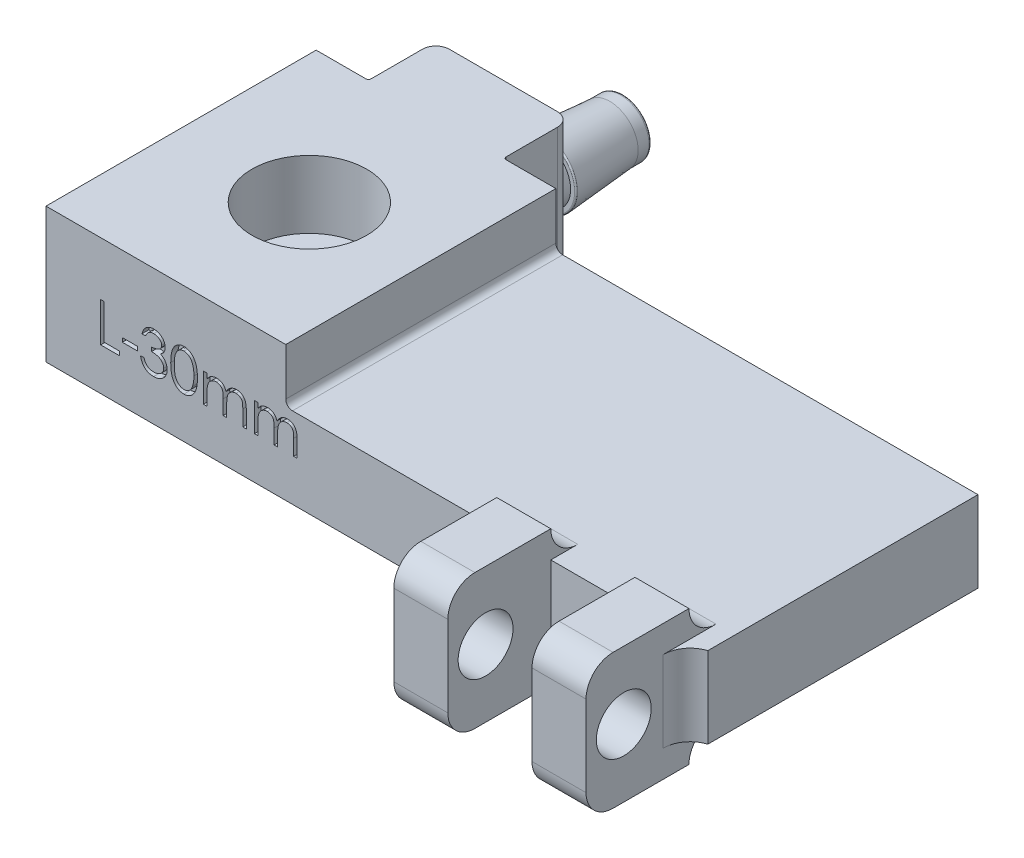
from build123d import *

# Parameters (mm, degrees)
SKETCH2_W           = 49
SKETCH2_H           = 20
BOSS_EXTRUDE1_DEPTH = 10
SKETCH3_W           = 30
SKETCH3_H           = 3.02
CUT_EXTRUDE1_DEPTH  = 2
SKETCH4_W           = 5
SKETCH4_H           = 6
CUT_EXTRUDE2_DEPTH  = 5
SKETCH5_R           = 4.25
CUT_EXTRUDE3_DEPTH  = 38.474986727
SKETCH6_W           = 1.65
SKETCH6_H           = 6
BOSS_EXTRUDE2_DEPTH = 0.5
SKETCH11_R          = 2
CUT_EXTRUDE4_DEPTH  = 2
SKETCH12_W          = 5
SKETCH12_H          = 6
BOSS_EXTRUDE4_DEPTH = 0.8
SKETCH14_W          = 31.25
SKETCH14_H          = 4
CUT_EXTRUDE6_DEPTH  = 42.177221974
FILLET1_R           = 0.5
SKETCH13_W          = 1.119391026
SKETCH13_H          = 0.298504274
CUT_EXTRUDE5_DEPTH  = 0.5
SKETCH19_W          = 10
SKETCH19_H          = 4.99
BOSS_EXTRUDE5_DEPTH = 10
FILLET2_R           = 1
CUT_EXTRUDE7_REACH  = 45.819
SKETCH20_R          = 0.5
SKETCH21_R          = 1.4
CUT_EXTRUDE8_DEPTH  = 10
FILLET3_R           = 0.2
BOSS_EXTRUDE6_START = -0.5
SKETCH24_W          = 1.7
SKETCH24_H          = 1.5
BOSS_EXTRUDE6_DEPTH = 0.5
SKETCH28_W          = 4
SKETCH28_H          = 10
BOSS_EXTRUDE7_DEPTH = 7.62
CUT_EXTRUDE10_REACH = 57.414
SKETCH30_R          = 2.032
FILLET4_R           = 2
FILLET5_R           = 2


with BuildPart() as part:
    # Sketch2 → Boss-Extrude1 (new body)
    with BuildSketch(Plane(origin=(0, 0, 0), x_dir=(1, 0, 0), z_dir=(0, 1, 0))):
        with Locations((10.076923077, 3.557692308)):
            Rectangle(SKETCH2_W, SKETCH2_H)
    extrude(amount=BOSS_EXTRUDE1_DEPTH)

    # Sketch3 → Cut-Extrude1 (cut)
    with BuildSketch(Plane.XZ):
        with Locations((12.576923077, -3.557692308)):
            Rectangle(SKETCH3_W, SKETCH3_H)
    extrude(amount=-CUT_EXTRUDE1_DEPTH, mode=Mode.SUBTRACT)

    # Sketch4 → Cut-Extrude2 (cut)
    with BuildSketch(Plane.XZ):
        with Locations((-4.923076923, -3.547692308)):
            Rectangle(SKETCH4_W, SKETCH4_H)
    extrude(amount=-CUT_EXTRUDE2_DEPTH, mode=Mode.SUBTRACT)

    # Sketch5 → Cut-Extrude3 (cut, through all)
    with BuildSketch(Plane.XZ.offset(-5)):
        with Locations(Location((-4.923076923, -3.552692308, 0), (0, 0, 270))):
            Circle(SKETCH5_R)
    extrude(amount=-CUT_EXTRUDE3_DEPTH, mode=Mode.SUBTRACT)

    # Sketch6 → Boss-Extrude2 (add)
    with BuildSketch(Plane(origin=(0, 5, 0), x_dir=(1, 0, 0), z_dir=(0, 1, 0))):
        with Locations((-3.248076923, 3.547692308)):
            Rectangle(SKETCH6_W, SKETCH6_H)
        with Locations((-6.598076923, 3.547692308)):
            Rectangle(SKETCH6_W, SKETCH6_H)
    extrude(amount=-BOSS_EXTRUDE2_DEPTH)

    # Sketch11 → Cut-Extrude4 (cut)
    with BuildSketch(Plane.XZ):
        with Locations((28.888372657, -3.557692308)):
            Circle(SKETCH11_R)
    extrude(amount=-CUT_EXTRUDE4_DEPTH, mode=Mode.SUBTRACT)

    # Sketch12 → Boss-Extrude4 (add)
    with BuildSketch(Plane.XZ):
        with Locations((-4.923076923, -3.547692308)):
            Rectangle(SKETCH12_W, SKETCH12_H)
    extrude(amount=-BOSS_EXTRUDE4_DEPTH)

    # Sketch14 → Cut-Extrude6 (cut, through all)
    with BuildSketch(Plane.XY.offset(6.442307692)):
        with Locations((18.951923077, 8)):
            Rectangle(SKETCH14_W, SKETCH14_H)
    extrude(amount=-CUT_EXTRUDE6_DEPTH, mode=Mode.SUBTRACT)

    # Fillet1
    fillet1_edges = [part.edges().sort_by_distance(p)[0] for p in [
        (3.326923077, 6, -3.557692308),
    ]]
    fillet(fillet1_edges, radius=FILLET1_R)

    # Sketch13 → Cut-Extrude5 (cut)
    # profile 1 of 6: a face of its own
    with BuildSketch(Plane.XY.offset(6.442307692)):
        Polygon((-10.374825021, 6.036177607), (-10.113633781, 6.036177607), (-10.113633781, 3.424265214), (-8.994242756, 3.424265214), (-8.994242756, 3.12576094), (-10.374825021, 3.12576094), align=None)
    # profile 2 of 6: a face of its own
    with BuildSketch(Plane.XY.offset(6.442307692)):
        with Locations((-8.210669038, 4.245151966)):
            Rectangle(SKETCH13_W, SKETCH13_H)
    # profile 3 of 6: a face of its own
    with BuildSketch(Plane.XY.offset(6.442307692)):
        with BuildLine():
            Line((-7.053964978, 5.364542992), (-7.315156217, 5.364542992))
            add(Edge.make_bspline(
                [(-7.315156217, 5.364542992), (-7.308080121, 5.39384048), (-7.294246931, 5.451114673), (-7.265394246, 5.532944996), (-7.233962365, 5.610381639), (-7.196219163, 5.681974624), (-7.155050277, 5.749162759), (-7.107882633, 5.810422144), (-7.056892363, 5.867310783), (-7.000492688, 5.917796731), (-6.941345819, 5.963513331), (-6.878618341, 6.002492173), (-6.81357228, 6.036023626), (-6.745756966, 6.063647831), (-6.674970501, 6.084457746), (-6.601852832, 6.099555994), (-6.52621235, 6.109360867), (-6.474866288, 6.110317781), (-6.448794205, 6.110803675)],
                knots=[0, 0, 0, 0, 1.162005537, 2.271625781, 3.343758855, 4.383309926, 5.390229558, 6.379919256, 7.361854164, 8.333198761, 9.295911338, 10.242430842, 11.177959212, 12.116337295, 13.062827104, 14.020064771, 14.994644689, 16, 16, 16, 16], degree=3))
            add(Edge.make_bspline(
                [(-6.448794205, 6.110803675), (-6.410806829, 6.10965678), (-6.335660693, 6.107388006), (-6.225261898, 6.086670465), (-6.118801501, 6.05388659), (-6.017444787, 6.008589092), (-5.923298269, 5.952719642), (-5.839531333, 5.886225155), (-5.767279399, 5.810388593), (-5.706664253, 5.726624669), (-5.659203673, 5.637103987), (-5.624206849, 5.54496838), (-5.602901202, 5.450436407), (-5.60014, 5.386609075), (-5.598756645, 5.354631717)],
                knots=[0, 0, 0, 0, 1.083050992, 2.142477498, 3.193116406, 4.255571735, 5.30263384, 6.308962982, 7.297363603, 8.282367274, 9.249857812, 10.179914175, 11.08814088, 12, 12, 12, 12], degree=3))
            add(Edge.make_bspline(
                [(-5.598756645, 5.354631717), (-5.599724226, 5.323858805), (-5.601617633, 5.263640992), (-5.617694529, 5.175728532), (-5.644749981, 5.092871797), (-5.682227635, 5.014721985), (-5.730741412, 4.941774604), (-5.789509125, 4.873865526), (-5.858945565, 4.810693554), (-5.911565015, 4.77450504), (-5.938655065, 4.755874122)],
                knots=[0, 0, 0, 0, 1.024540389, 2.004866551, 2.965041327, 3.920577974, 4.882998113, 5.874504559, 6.905732034, 8, 8, 8, 8], degree=3))
            add(Edge.make_bspline(
                [(-5.938655065, 4.755874122), (-5.907695089, 4.740924416), (-5.84635442, 4.711304725), (-5.762741866, 4.653216336), (-5.686839967, 4.586146742), (-5.6445111, 4.533806929), (-5.623243323, 4.507509238)],
                knots=[0, 0, 0, 0, 1.015518401, 2.012035669, 3.001164323, 4, 4, 4, 4], degree=3))
            add(Edge.make_bspline(
                [(-5.623243323, 4.507509238), (-5.609238945, 4.488335619), (-5.58145952, 4.450302364), (-5.54717021, 4.389153324), (-5.51606275, 4.32732652), (-5.491822955, 4.2631648), (-5.47305171, 4.197411823), (-5.459633831, 4.129954688), (-5.45129828, 4.060738309), (-5.45010455, 4.0139118), (-5.449504508, 3.990373905)],
                knots=[0, 0, 0, 0, 1.025084078, 2.033381695, 3.024893161, 4.013698104, 4.991890475, 5.976764909, 6.982997093, 8, 8, 8, 8], degree=3))
            add(Edge.make_bspline(
                [(-5.449504508, 3.990373905), (-5.450996731, 3.949619988), (-5.453974156, 3.868303942), (-5.480587068, 3.748166331), (-5.52184284, 3.630730601), (-5.580431137, 3.51840944), (-5.65183406, 3.413318135), (-5.736782739, 3.3192898), (-5.834311973, 3.238464532), (-5.943083099, 3.17093436), (-6.06092764, 3.116952016), (-6.186969962, 3.079484607), (-6.319393965, 3.055082011), (-6.410205034, 3.05246524), (-6.456373415, 3.051134872)],
                knots=[0, 0, 0, 0, 0.955779014, 1.907060117, 2.875433937, 3.871313158, 4.872415639, 5.851225146, 6.836215519, 7.83643374, 8.849228613, 9.86973379, 10.916971861, 12, 12, 12, 12], degree=3))
            add(Edge.make_bspline(
                [(-6.456373415, 3.051134872), (-6.487489345, 3.051856833), (-6.548715119, 3.053277411), (-6.638724743, 3.062988724), (-6.724641656, 3.080725639), (-6.806582024, 3.104593804), (-6.88461864, 3.13485527), (-6.958513375, 3.172539926), (-7.028720852, 3.216870978), (-7.094578551, 3.268371706), (-7.156078622, 3.325982439), (-7.211586691, 3.390725913), (-7.262028198, 3.461405302), (-7.306052523, 3.538841558), (-7.345664917, 3.622033953), (-7.378245749, 3.712047734), (-7.406922141, 3.808078198), (-7.42025473, 3.874999271), (-7.42709532, 3.909334658)],
                knots=[0, 0, 0, 0, 1.048658725, 2.063410685, 3.046034179, 4.001477787, 4.936774919, 5.862367409, 6.792675028, 7.730719943, 8.675894397, 9.627829632, 10.600096036, 11.597688215, 12.626045268, 13.701542398, 14.82072376, 16, 16, 16, 16], degree=3))
            Line((-7.42709532, 3.909334658), (-7.16590408, 3.909334658))
            add(Edge.make_bspline(
                [(-7.16590408, 3.909334658), (-7.159099284, 3.886925271), (-7.145863364, 3.843337065), (-7.123333165, 3.780604858), (-7.097664727, 3.723096644), (-7.070128394, 3.67039056), (-7.04120846, 3.621967544), (-7.008848847, 3.579108025), (-6.97544629, 3.539929491), (-6.950267566, 3.517856382), (-6.937944762, 3.507053509)],
                knots=[0, 0, 0, 0, 1.198163088, 2.33053128, 3.407730985, 4.417276592, 5.372219308, 6.28897303, 7.162600585, 8, 8, 8, 8], degree=3))
            add(Edge.make_bspline(
                [(-6.937944762, 3.507053509), (-6.921649276, 3.494490209), (-6.889108603, 3.469402391), (-6.836082282, 3.437386454), (-6.780314636, 3.409645173), (-6.720597315, 3.388454266), (-6.658218961, 3.370511414), (-6.592171324, 3.35876953), (-6.523037106, 3.350713354), (-6.475832008, 3.350002438), (-6.451709285, 3.349639146)],
                knots=[0, 0, 0, 0, 0.946170439, 1.889420265, 2.845303464, 3.807233317, 4.801018734, 5.828864929, 6.890507805, 8, 8, 8, 8], degree=3))
            add(Edge.make_bspline(
                [(-6.451709285, 3.349639146), (-6.424473188, 3.3501513), (-6.371215352, 3.351152774), (-6.293503186, 3.360362752), (-6.219572409, 3.373775959), (-6.150243852, 3.39449229), (-6.084609376, 3.420088034), (-6.02358904, 3.452226023), (-5.966381802, 3.489932319), (-5.913720385, 3.532789583), (-5.866367484, 3.579706743), (-5.824674091, 3.628778922), (-5.789229656, 3.679799216), (-5.760638073, 3.733049963), (-5.738061098, 3.78831065), (-5.722691436, 3.845736356), (-5.712004789, 3.904857118), (-5.711134482, 3.945044957), (-5.710695747, 3.96530421)],
                knots=[0, 0, 0, 0, 1.217147791, 2.380027433, 3.494444702, 4.572153297, 5.609568379, 6.639424714, 7.649109417, 8.668170816, 9.669597737, 10.625200337, 11.543417969, 12.441394052, 13.322311151, 14.205496177, 15.095365482, 16, 16, 16, 16], degree=3))
            add(Edge.make_bspline(
                [(-5.710695747, 3.96530421), (-5.711968266, 3.992422091), (-5.714506971, 4.046522918), (-5.733889165, 4.126116639), (-5.765769756, 4.202804798), (-5.810401005, 4.275278988), (-5.864730775, 4.342447997), (-5.928231831, 4.402378866), (-6.001431495, 4.451831079), (-6.068803374, 4.485998253), (-6.128479519, 4.509312417), (-6.179549336, 4.524841539), (-6.236723726, 4.537991347), (-6.299311279, 4.550225301), (-6.367783584, 4.560637398), (-6.442066097, 4.569320265), (-6.522173871, 4.57626788), (-6.577630751, 4.579370463), (-6.606208568, 4.580969274)],
                knots=[0, 0, 0, 0, 1.07054697, 2.135767047, 3.216561865, 4.33974944, 5.486079747, 6.621378074, 7.775625952, 8.963672916, 9.598146892, 10.304877434, 11.070270905, 11.915000392, 12.823868403, 13.805723172, 14.86925407, 16, 16, 16, 16], degree=3))
            Line((-6.606208568, 4.580969274), (-6.606208568, 4.879473547))
            add(Edge.make_bspline(
                [(-6.606208568, 4.879473547), (-6.570201586, 4.880084572), (-6.499672755, 4.881281418), (-6.396648741, 4.895757008), (-6.298132541, 4.915781197), (-6.206307446, 4.94645299), (-6.122613248, 4.982076737), (-6.050002841, 5.023531223), (-5.989493493, 5.069611226), (-5.941379257, 5.121027985), (-5.90518263, 5.176172105), (-5.878717133, 5.233645897), (-5.863083766, 5.293953107), (-5.860996859, 5.335110281), (-5.859947884, 5.355797749)],
                knots=[0, 0, 0, 0, 1.321986639, 2.589447074, 3.816329219, 5.01088745, 6.139805852, 7.153945165, 8.075214402, 8.924034688, 9.728124013, 10.488707548, 11.240355623, 12, 12, 12, 12], degree=3))
            add(Edge.make_bspline(
                [(-5.859947884, 5.355797749), (-5.860292486, 5.370996565), (-5.860978057, 5.401233887), (-5.869623888, 5.445409912), (-5.882616022, 5.488235401), (-5.90047744, 5.529528235), (-5.924384599, 5.569002028), (-5.952994815, 5.606993317), (-5.987061742, 5.643285198), (-6.026099116, 5.677112821), (-6.068018933, 5.709351287), (-6.113961752, 5.736720544), (-6.162542322, 5.760124503), (-6.21381443, 5.779424309), (-6.267944463, 5.793942539), (-6.324678095, 5.804366688), (-6.384123508, 5.810884071), (-6.424679526, 5.811822403), (-6.445296108, 5.812299402)],
                knots=[0, 0, 0, 0, 0.884392785, 1.759457502, 2.611959086, 3.489218968, 4.37281399, 5.2945488, 6.255912374, 7.266815255, 8.301784654, 9.332968512, 10.37626691, 11.440494194, 12.520033166, 13.637162961, 14.798855837, 16, 16, 16, 16], degree=3))
            add(Edge.make_bspline(
                [(-6.445296108, 5.812299402), (-6.478434667, 5.811142418), (-6.543161982, 5.80888256), (-6.636474029, 5.789089221), (-6.723220523, 5.757508636), (-6.789527021, 5.719812071), (-6.838490685, 5.682599955), (-6.873479663, 5.650101089), (-6.907839635, 5.613984628), (-6.939310118, 5.572026086), (-6.971136752, 5.527066976), (-7.000111664, 5.476821807), (-7.02826761, 5.422601248), (-7.045233302, 5.384270533), (-7.053964978, 5.364542992)],
                knots=[0, 0, 0, 0, 1.472543308, 2.876219568, 4.221790263, 5.565193594, 6.249813518, 6.953379497, 7.687249741, 8.463570142, 9.283606569, 10.136032583, 11.040678096, 12, 12, 12, 12], degree=3))
        make_face()
    # profile 4 of 6: a face of its own
    with BuildSketch(Plane.XY.offset(6.442307692)):
        with BuildLine():
            add(Edge.make_bspline(
                [(-5.188313269, 4.579803241), (-5.188040506, 4.626450891), (-5.18751066, 4.717064622), (-5.181616301, 4.849101613), (-5.171824543, 4.972969186), (-5.158405549, 5.088673272), (-5.142075633, 5.196243739), (-5.120276208, 5.295393117), (-5.095485443, 5.386580302), (-5.066753439, 5.470102648), (-5.034333236, 5.547085417), (-4.999047127, 5.618952087), (-4.959494735, 5.68559392), (-4.917936553, 5.748074571), (-4.872690324, 5.805371274), (-4.825043651, 5.858293179), (-4.773136889, 5.905617178), (-4.718734542, 5.948729847), (-4.661344065, 5.986523247), (-4.602601324, 6.019812376), (-4.542101989, 6.048251194), (-4.479680884, 6.070611872), (-4.415899054, 6.089081248), (-4.350533535, 6.101711582), (-4.283476401, 6.109658606), (-4.238214071, 6.110418364), (-4.215259299, 6.110803675)],
                knots=[0, 0, 0, 0, 1.646270934, 3.197905019, 4.663502075, 6.030701355, 7.308322542, 8.50163776, 9.611534131, 10.641858119, 11.616356847, 12.558055219, 13.465016945, 14.349605745, 15.204443733, 16.039544428, 16.859896111, 17.680448484, 18.487036065, 19.28249412, 20.06191084, 20.843045899, 21.620316918, 22.403196591, 23.190181807, 24, 24, 24, 24], degree=3))
            add(Edge.make_bspline(
                [(-4.215259299, 6.110803675), (-4.192112773, 6.110398034), (-4.146081616, 6.109591341), (-4.078027446, 6.101838038), (-4.011545479, 6.088973063), (-3.946919146, 6.070744729), (-3.883617594, 6.048130228), (-3.822135951, 6.019785167), (-3.762092324, 5.9867903), (-3.704440888, 5.948020325), (-3.648548735, 5.904794587), (-3.595788733, 5.85593063), (-3.546156078, 5.801921846), (-3.499027863, 5.743346081), (-3.455741155, 5.679079853), (-3.414518486, 5.610240924), (-3.377621025, 5.535625437), (-3.342085107, 5.456478345), (-3.311411821, 5.370609696), (-3.283749354, 5.278503523), (-3.261398212, 5.179071893), (-3.242780466, 5.072836491), (-3.228357359, 4.959407173), (-3.217852716, 4.839027088), (-3.212303728, 4.711617037), (-3.211258721, 4.624505897), (-3.210722457, 4.579803241)],
                knots=[0, 0, 0, 0, 0.810914788, 1.612654377, 2.396697861, 3.181598691, 3.963628158, 4.749916497, 5.551656086, 6.361998678, 7.18212741, 8.025565596, 8.878627764, 9.750805457, 10.657531673, 11.591944965, 12.560506719, 13.57287815, 14.630710178, 15.753379473, 16.941251878, 18.199788006, 19.531962791, 20.947069417, 22.433333509, 24, 24, 24, 24], degree=3))
            add(Edge.make_bspline(
                [(-3.210722457, 4.579803241), (-3.21126428, 4.535295563), (-3.212320001, 4.448574167), (-3.217790509, 4.321737398), (-3.228566228, 4.201996168), (-3.242045605, 4.089063301), (-3.26071465, 3.983408841), (-3.28366966, 3.884667177), (-3.309156863, 3.792411899), (-3.340618296, 3.707398785), (-3.375053274, 3.628441906), (-3.412518815, 3.554710949), (-3.452657474, 3.485554217), (-3.49638752, 3.421525261), (-3.542998602, 3.362170508), (-3.593488335, 3.308537664), (-3.646433458, 3.259334432), (-3.702490092, 3.215552097), (-3.76104065, 3.177230387), (-3.820878049, 3.142959108), (-3.883063993, 3.11532454), (-3.946189228, 3.091596294), (-4.011156685, 3.07346818), (-4.07788538, 3.060933552), (-4.146035893, 3.052142556), (-4.192104933, 3.05147193), (-4.215259299, 3.051134872)],
                knots=[0, 0, 0, 0, 1.561518951, 3.042555995, 4.452378317, 5.7783523, 7.031515105, 8.214008947, 9.334062868, 10.386615937, 11.391082383, 12.354592575, 13.286541444, 14.194233754, 15.072674879, 15.931287219, 16.775624067, 17.606195743, 18.42308326, 19.229000347, 20.022332153, 20.807536673, 21.593273796, 22.3848459, 23.188221202, 24, 24, 24, 24], degree=3))
            add(Edge.make_bspline(
                [(-4.215259299, 3.051134872), (-4.238213434, 3.051522669), (-4.283474508, 3.052287328), (-4.350540841, 3.060198449), (-4.41563642, 3.072917388), (-4.479082467, 3.090726315), (-4.541204492, 3.112525199), (-4.601155988, 3.140925614), (-4.659603544, 3.173633765), (-4.716391225, 3.210883291), (-4.770451932, 3.253559714), (-4.82208988, 3.300761924), (-4.870007827, 3.35366782), (-4.914607132, 3.411442021), (-4.956994513, 3.473553009), (-4.99598526, 3.540848805), (-5.03205019, 3.613062571), (-5.065015641, 3.690660857), (-5.094243428, 3.774775997), (-5.120061076, 3.866370284), (-5.140445765, 3.966252155), (-5.157894092, 4.073619394), (-5.171967522, 4.188933371), (-5.181575494, 4.312256688), (-5.187513837, 4.443512495), (-5.188041929, 4.533543968), (-5.188313269, 4.579803241)],
                knots=[0, 0, 0, 0, 0.810891512, 1.598919785, 2.382837074, 3.152667961, 3.926044502, 4.706494248, 5.493654104, 6.291793342, 7.103789334, 7.925228297, 8.761435821, 9.622817696, 10.50288917, 11.416980706, 12.369136599, 13.353924996, 14.394355917, 15.514179734, 16.714354668, 17.994756427, 19.357759367, 20.818452758, 22.365282078, 24, 24, 24, 24], degree=3))
        make_face()
        with BuildLine():
            add(Edge.make_bspline(
                [(-4.927122029, 4.580969274), (-4.927022703, 4.542095505), (-4.926829931, 4.466649152), (-4.921793912, 4.357015202), (-4.914933451, 4.254759518), (-4.906084706, 4.159752262), (-4.892943802, 4.072315019), (-4.878219764, 3.99184642), (-4.860301502, 3.918772312), (-4.83910118, 3.852591258), (-4.814953788, 3.792180098), (-4.788588853, 3.735966468), (-4.76026574, 3.683286317), (-4.728567851, 3.634612834), (-4.694046099, 3.589787291), (-4.65748024, 3.548016299), (-4.617505597, 3.510765476), (-4.562204568, 3.466089038), (-4.489197619, 3.419922234), (-4.397211443, 3.379720158), (-4.302690713, 3.354455699), (-4.238535775, 3.351242802), (-4.206514056, 3.349639146)],
                knots=[0, 0, 0, 0, 1.459021318, 2.831673884, 4.118529203, 5.306027144, 6.411944654, 7.436330062, 8.375795394, 9.233974572, 10.042671642, 10.816086306, 11.563610507, 12.285937304, 12.993564865, 13.685989202, 14.367179055, 15.041617293, 16.353048772, 17.594441528, 18.799311195, 20, 20, 20, 20], degree=3))
            add(Edge.make_bspline(
                [(-4.206514056, 3.349639146), (-4.174285207, 3.350967776), (-4.109894048, 3.353622295), (-4.01581791, 3.379232912), (-3.924488811, 3.417874547), (-3.852915894, 3.463566014), (-3.798464041, 3.507079512), (-3.759450329, 3.544178716), (-3.723642185, 3.585719399), (-3.689680055, 3.63053923), (-3.65853105, 3.679494504), (-3.630205929, 3.732349812), (-3.604358645, 3.789251932), (-3.58963273, 3.828974745), (-3.58210375, 3.849283994)],
                knots=[0, 0, 0, 0, 1.353760809, 2.704726607, 4.075137775, 5.516104923, 6.260822281, 7.007110065, 7.778089737, 8.566572457, 9.372053459, 10.217411131, 11.088608312, 12, 12, 12, 12], degree=3))
            add(Edge.make_bspline(
                [(-3.58210375, 3.849283994), (-3.573329453, 3.875253009), (-3.555513866, 3.927981248), (-3.532553361, 4.009775309), (-3.514471026, 4.095593321), (-3.498203156, 4.184922421), (-3.487099454, 4.278421387), (-3.478162135, 4.375800922), (-3.472897868, 4.477134447), (-3.47224531, 4.545982425), (-3.471913696, 4.580969274)],
                knots=[0, 0, 0, 0, 0.884706709, 1.796334032, 2.740027952, 3.714592787, 4.726048262, 5.777819803, 6.87074269, 8, 8, 8, 8], degree=3))
            add(Edge.make_bspline(
                [(-3.471913696, 4.580969274), (-3.472371204, 4.615950464), (-3.473266189, 4.684381149), (-3.476687166, 4.784597755), (-3.485521174, 4.879783149), (-3.495332703, 4.970347393), (-3.509799321, 5.055789163), (-3.52539733, 5.136823732), (-3.546353338, 5.212447188), (-3.568738413, 5.283843519), (-3.594358724, 5.350201563), (-3.622561272, 5.411830705), (-3.65268139, 5.46902848), (-3.685396336, 5.521637954), (-3.720317746, 5.569894777), (-3.758367327, 5.612831401), (-3.798035785, 5.651778571), (-3.853597457, 5.696235243), (-3.926336494, 5.741564313), (-4.016846833, 5.783279531), (-4.111036768, 5.807234999), (-4.174711241, 5.810612485), (-4.206514056, 5.812299402)],
                knots=[0, 0, 0, 0, 1.31362396, 2.569729283, 3.763502607, 4.902122613, 5.988968491, 7.01645872, 7.998833611, 8.933434873, 9.825090667, 10.667526885, 11.477055099, 12.250526234, 12.991942729, 13.710640831, 14.402115721, 15.076753259, 16.378508321, 17.609869233, 18.806226677, 20, 20, 20, 20], degree=3))
            add(Edge.make_bspline(
                [(-4.206514056, 5.812299402), (-4.238703757, 5.810610157), (-4.3031418, 5.807228591), (-4.398310725, 5.783368784), (-4.489535117, 5.741780621), (-4.562081805, 5.696085107), (-4.617682227, 5.652563309), (-4.656833729, 5.614822311), (-4.693543373, 5.573539086), (-4.727360503, 5.528301303), (-4.759033555, 5.479684566), (-4.788121933, 5.427306409), (-4.814330094, 5.3709014), (-4.83851527, 5.310517376), (-4.859780261, 5.244342031), (-4.877320896, 5.171357933), (-4.893525309, 5.091145277), (-4.904996732, 5.003234472), (-4.915194629, 4.908203419), (-4.921748345, 4.805692459), (-4.926846777, 4.695874637), (-4.927028441, 4.620038194), (-4.927122029, 4.580969274)],
                knots=[0, 0, 0, 0, 1.207732386, 2.417664972, 3.655092373, 4.956220595, 5.625982001, 6.301752483, 6.994047911, 7.697131622, 8.419323945, 9.170223765, 9.943494443, 10.752040957, 11.610060368, 12.549350801, 13.567764191, 14.679664412, 15.874934091, 17.154273443, 18.533957287, 20, 20, 20, 20], degree=3))
        make_face(mode=Mode.SUBTRACT)
    # profile 5 of 6: a face of its own
    with BuildSketch(Plane.XY.offset(6.442307692)):
        with BuildLine():
            Line((-2.762966046, 5.252603889), (-2.501774807, 5.252603889))
            Line((-2.501774807, 5.252603889), (-2.501774807, 4.882971644))
            add(Edge.make_bspline(
                [(-2.501774807, 4.882971644), (-2.478255356, 4.915308537), (-2.433189832, 4.977269123), (-2.359293811, 5.05891902), (-2.285472246, 5.128210349), (-2.232308594, 5.16458463), (-2.20676863, 5.182058934)],
                knots=[0, 0, 0, 0, 1.134379233, 2.173579362, 3.122582517, 4, 4, 4, 4], degree=3))
            add(Edge.make_bspline(
                [(-2.20676863, 5.182058934), (-2.17195617, 5.198694348), (-2.102939464, 5.231674535), (-1.993658121, 5.265130655), (-1.88183603, 5.285690755), (-1.806324675, 5.288502528), (-1.768340479, 5.289916923)],
                knots=[0, 0, 0, 0, 1.014936303, 2.012140481, 3.000054389, 4, 4, 4, 4], degree=3))
            add(Edge.make_bspline(
                [(-1.768340479, 5.289916923), (-1.742651481, 5.289047714), (-1.691814336, 5.287327596), (-1.616489351, 5.276134936), (-1.543430732, 5.256788005), (-1.473070137, 5.229839772), (-1.406778596, 5.197204283), (-1.346001448, 5.158911758), (-1.291431794, 5.115923178), (-1.243097214, 5.066297304), (-1.199633031, 5.00864062), (-1.15965318, 4.941398147), (-1.122711501, 4.86305999), (-1.10223771, 4.806209956), (-1.091458718, 4.776279687)],
                knots=[0, 0, 0, 0, 1.009824226, 1.998387844, 2.986035974, 3.974953746, 4.955485308, 5.885931332, 6.793869504, 7.679848016, 8.601185859, 9.625726857, 10.749998409, 12, 12, 12, 12], degree=3))
            add(Edge.make_bspline(
                [(-1.091458718, 4.776279687), (-1.080057159, 4.796839219), (-1.057620494, 4.837297491), (-1.019946699, 4.894556415), (-0.980474966, 4.948113729), (-0.938868902, 4.998011928), (-0.895275362, 5.044004603), (-0.849489186, 5.086243814), (-0.801771007, 5.124910956), (-0.73541996, 5.17008325), (-0.649094834, 5.21806453), (-0.540255134, 5.259665564), (-0.427039783, 5.285373797), (-0.350190066, 5.288392541), (-0.311383097, 5.289916923)],
                knots=[0, 0, 0, 0, 0.86119277, 1.694706429, 2.50939023, 3.298075842, 4.073795165, 4.829715201, 5.57930267, 6.321991688, 7.768977793, 9.186738141, 10.579381044, 12, 12, 12, 12], degree=3))
            add(Edge.make_bspline(
                [(-0.311383097, 5.289916923), (-0.275725119, 5.288572127), (-0.205938993, 5.285940231), (-0.104342778, 5.265273384), (-0.009594742, 5.229784888), (0.07811447, 5.181360846), (0.157244386, 5.120508871), (0.226026936, 5.048106986), (0.284044316, 4.964667317), (0.321945125, 4.886175883), (0.347652639, 4.816878586), (0.363502963, 4.757833473), (0.377505972, 4.692846735), (0.389132043, 4.621840667), (0.397629256, 4.544564441), (0.403924666, 4.461144518), (0.408185577, 4.371516065), (0.408486658, 4.309677611), (0.40864186, 4.277800871)],
                knots=[0, 0, 0, 0, 1.209669288, 2.367440248, 3.500751976, 4.631527125, 5.755587489, 6.87532382, 8.007944318, 9.190864318, 9.82315674, 10.514484317, 11.263564316, 12.079023757, 12.955305781, 13.901327259, 14.918167583, 16, 16, 16, 16], degree=3))
            Line((0.40864186, 4.277800871), (0.40864186, 3.12576094))
            Line((0.40864186, 3.12576094), (0.14745062, 3.12576094))
            Line((0.14745062, 3.12576094), (0.14745062, 4.278966903))
            add(Edge.make_bspline(
                [(0.14745062, 4.278966903), (0.147385857, 4.306175619), (0.147261392, 4.358466632), (0.145021509, 4.433515843), (0.140801143, 4.501925899), (0.135866209, 4.563603522), (0.129011089, 4.618692545), (0.120158489, 4.667082312), (0.110780561, 4.709153475), (0.095200693, 4.755791695), (0.070297595, 4.807239721), (0.032364488, 4.862723551), (-0.015424642, 4.911020502), (-0.070606272, 4.952945734), (-0.133428402, 4.987033898), (-0.202666984, 5.011378295), (-0.277892151, 5.026448331), (-0.329965981, 5.027950119), (-0.356858357, 5.028725684)],
                knots=[0, 0, 0, 0, 1.253487763, 2.409012846, 3.458416907, 4.410876679, 5.259312806, 6.014470957, 6.676830364, 7.243083969, 8.276244668, 9.299465089, 10.325150304, 11.392391894, 12.482080715, 13.603491619, 14.762376348, 16, 16, 16, 16], degree=3))
            add(Edge.make_bspline(
                [(-0.356858357, 5.028725684), (-0.389845813, 5.027548082), (-0.455041568, 5.025220692), (-0.550208439, 5.001460156), (-0.641654576, 4.965636876), (-0.726651327, 4.913721315), (-0.804839912, 4.851514598), (-0.872111763, 4.777548774), (-0.927685908, 4.693870197), (-0.965316744, 4.616414279), (-0.989090109, 4.546839152), (-1.004787164, 4.486055206), (-1.016997103, 4.416968926), (-1.028447954, 4.340044543), (-1.035921678, 4.254752553), (-1.042714068, 4.161487502), (-1.045891298, 4.059968876), (-1.046335725, 3.989597755), (-1.046566474, 3.95306087)],
                knots=[0, 0, 0, 0, 1.090531906, 2.155305635, 3.229839962, 4.33261226, 5.44038871, 6.529323825, 7.629011124, 8.757537029, 9.370236727, 10.061839251, 10.834451254, 11.692844982, 12.636905849, 13.66920014, 14.789842145, 16, 16, 16, 16], degree=3))
            Line((-1.046566474, 3.95306087), (-1.046566474, 3.12576094))
            Line((-1.046566474, 3.12576094), (-1.307757713, 3.12576094))
            Line((-1.307757713, 3.12576094), (-1.307757713, 4.207255916))
            add(Edge.make_bspline(
                [(-1.307757713, 4.207255916), (-1.307823764, 4.237768158), (-1.307950838, 4.296470644), (-1.310176324, 4.380651266), (-1.314406092, 4.457221069), (-1.319296048, 4.52609106), (-1.326331089, 4.587136075), (-1.334322064, 4.640683383), (-1.343758974, 4.686598741), (-1.359383658, 4.736960079), (-1.383261106, 4.792441704), (-1.421668845, 4.851598851), (-1.469572291, 4.903377739), (-1.525760692, 4.94758177), (-1.588963036, 4.984121204), (-1.658799233, 5.010447795), (-1.734640461, 5.025768469), (-1.786926268, 5.027721356), (-1.813815739, 5.028725684)],
                knots=[0, 0, 0, 0, 1.320475261, 2.540461679, 3.643808994, 4.639130445, 5.527981419, 6.302341397, 6.981980563, 7.553956391, 8.582137848, 9.585246428, 10.591171744, 11.620968678, 12.668337649, 13.738356861, 14.836885341, 16, 16, 16, 16], degree=3))
            add(Edge.make_bspline(
                [(-1.813815739, 5.028725684), (-1.845428029, 5.027453034), (-1.908430201, 5.024916687), (-2.000983089, 5.002087151), (-2.090362553, 4.966327215), (-2.17514274, 4.916717234), (-2.253037255, 4.855266631), (-2.321231034, 4.782992757), (-2.378560027, 4.700795078), (-2.416588209, 4.624155894), (-2.441117595, 4.556323831), (-2.457412049, 4.498655216), (-2.471415, 4.434625843), (-2.481821005, 4.364038168), (-2.491866446, 4.287351936), (-2.496714625, 4.204185126), (-2.501430799, 4.11460908), (-2.501657325, 4.052764767), (-2.501774807, 4.020690745)],
                knots=[0, 0, 0, 0, 1.098833095, 2.189935336, 3.297829714, 4.440610912, 5.596351641, 6.740013378, 7.886572111, 9.072425424, 9.705826452, 10.395263256, 11.156850408, 11.985370555, 12.878090359, 13.847760091, 14.883794034, 16, 16, 16, 16], degree=3))
            Line((-2.501774807, 4.020690745), (-2.501774807, 3.12576094))
            Line((-2.501774807, 3.12576094), (-2.762966046, 3.12576094))
            Line((-2.762966046, 3.12576094), (-2.762966046, 5.252603889))
        make_face()
    # profile 6 of 6: a face of its own
    with BuildSketch(Plane.XY.offset(6.442307692)):
        with BuildLine():
            Line((1.005650407, 5.252603889), (1.266841646, 5.252603889))
            Line((1.266841646, 5.252603889), (1.266841646, 4.882971644))
            add(Edge.make_bspline(
                [(1.266841646, 4.882971644), (1.290361097, 4.915308537), (1.335426621, 4.977269123), (1.409322642, 5.05891902), (1.483144207, 5.128210349), (1.536307859, 5.16458463), (1.561847823, 5.182058934)],
                knots=[0, 0, 0, 0, 1.134379233, 2.173579362, 3.122582517, 4, 4, 4, 4], degree=3))
            add(Edge.make_bspline(
                [(1.561847823, 5.182058934), (1.596660283, 5.198694348), (1.665676989, 5.231674535), (1.774958332, 5.265130655), (1.886780423, 5.285690755), (1.962291778, 5.288502528), (2.000275974, 5.289916923)],
                knots=[0, 0, 0, 0, 1.014936303, 2.012140481, 3.000054389, 4, 4, 4, 4], degree=3))
            add(Edge.make_bspline(
                [(2.000275974, 5.289916923), (2.025964972, 5.289047714), (2.076802117, 5.287327596), (2.152127102, 5.276134936), (2.225185721, 5.256788005), (2.295546316, 5.229839772), (2.361837857, 5.197204283), (2.422615005, 5.158911758), (2.477184659, 5.115923178), (2.525519239, 5.066297304), (2.568983422, 5.00864062), (2.608963273, 4.941398147), (2.645904952, 4.86305999), (2.666378743, 4.806209956), (2.677157735, 4.776279687)],
                knots=[0, 0, 0, 0, 1.009824226, 1.998387844, 2.986035974, 3.974953746, 4.955485308, 5.885931332, 6.793869504, 7.679848016, 8.601185859, 9.625726857, 10.749998409, 12, 12, 12, 12], degree=3))
            add(Edge.make_bspline(
                [(2.677157735, 4.776279687), (2.688559294, 4.796839219), (2.710995959, 4.837297491), (2.748669754, 4.894556415), (2.788141487, 4.948113729), (2.829747551, 4.998011928), (2.873341091, 5.044004603), (2.919127267, 5.086243814), (2.966845446, 5.124910956), (3.033196493, 5.17008325), (3.119521619, 5.21806453), (3.228361319, 5.259665564), (3.34157667, 5.285373797), (3.418426387, 5.288392541), (3.457233356, 5.289916923)],
                knots=[0, 0, 0, 0, 0.86119277, 1.694706429, 2.50939023, 3.298075842, 4.073795165, 4.829715201, 5.57930267, 6.321991688, 7.768977793, 9.186738141, 10.579381044, 12, 12, 12, 12], degree=3))
            add(Edge.make_bspline(
                [(3.457233356, 5.289916923), (3.492891334, 5.288572127), (3.56267746, 5.285940231), (3.664273675, 5.265273384), (3.759021711, 5.229784888), (3.846730923, 5.181360846), (3.925860839, 5.120508871), (3.994643389, 5.048106986), (4.052660769, 4.964667317), (4.090561578, 4.886175883), (4.116269092, 4.816878586), (4.132119416, 4.757833473), (4.146122425, 4.692846735), (4.157748496, 4.621840667), (4.166245709, 4.544564441), (4.172541119, 4.461144518), (4.17680203, 4.371516065), (4.177103111, 4.309677611), (4.177258313, 4.277800871)],
                knots=[0, 0, 0, 0, 1.209669288, 2.367440248, 3.500751976, 4.631527125, 5.755587489, 6.87532382, 8.007944318, 9.190864318, 9.82315674, 10.514484317, 11.263564316, 12.079023757, 12.955305781, 13.901327259, 14.918167583, 16, 16, 16, 16], degree=3))
            Line((4.177258313, 4.277800871), (4.177258313, 3.12576094))
            Line((4.177258313, 3.12576094), (3.916067073, 3.12576094))
            Line((3.916067073, 3.12576094), (3.916067073, 4.278966903))
            add(Edge.make_bspline(
                [(3.916067073, 4.278966903), (3.91600231, 4.306175619), (3.915877845, 4.358466632), (3.913637962, 4.433515843), (3.909417596, 4.501925899), (3.904482662, 4.563603522), (3.897627542, 4.618692545), (3.888774942, 4.667082312), (3.879397014, 4.709153475), (3.863817146, 4.755791695), (3.838914048, 4.807239721), (3.800980941, 4.862723551), (3.753191811, 4.911020502), (3.698010181, 4.952945734), (3.635188051, 4.987033898), (3.565949469, 5.011378295), (3.490724302, 5.026448331), (3.438650472, 5.027950119), (3.411758096, 5.028725684)],
                knots=[0, 0, 0, 0, 1.253487763, 2.409012846, 3.458416907, 4.410876679, 5.259312806, 6.014470957, 6.676830364, 7.243083969, 8.276244668, 9.299465089, 10.325150304, 11.392391894, 12.482080715, 13.603491619, 14.762376348, 16, 16, 16, 16], degree=3))
            add(Edge.make_bspline(
                [(3.411758096, 5.028725684), (3.37877064, 5.027548082), (3.313574885, 5.025220692), (3.218408014, 5.001460156), (3.126961877, 4.965636876), (3.041965126, 4.913721315), (2.963776541, 4.851514598), (2.89650469, 4.777548774), (2.840930545, 4.693870197), (2.803299709, 4.616414279), (2.779526344, 4.546839152), (2.763829289, 4.486055206), (2.75161935, 4.416968926), (2.740168499, 4.340044543), (2.732694775, 4.254752553), (2.725902385, 4.161487502), (2.722725155, 4.059968876), (2.722280728, 3.989597755), (2.722049979, 3.95306087)],
                knots=[0, 0, 0, 0, 1.090531906, 2.155305635, 3.229839962, 4.33261226, 5.44038871, 6.529323825, 7.629011124, 8.757537029, 9.370236727, 10.061839251, 10.834451254, 11.692844982, 12.636905849, 13.66920014, 14.789842145, 16, 16, 16, 16], degree=3))
            Line((2.722049979, 3.95306087), (2.722049979, 3.12576094))
            Line((2.722049979, 3.12576094), (2.46085874, 3.12576094))
            Line((2.46085874, 3.12576094), (2.46085874, 4.207255916))
            add(Edge.make_bspline(
                [(2.46085874, 4.207255916), (2.460792689, 4.237768158), (2.460665615, 4.296470644), (2.458440129, 4.380651266), (2.454210361, 4.457221069), (2.449320405, 4.52609106), (2.442285364, 4.587136075), (2.434294389, 4.640683383), (2.424857479, 4.686598741), (2.409232795, 4.736960079), (2.385355347, 4.792441704), (2.346947608, 4.851598851), (2.299044162, 4.903377739), (2.242855761, 4.94758177), (2.179653417, 4.984121204), (2.10981722, 5.010447795), (2.033975992, 5.025768469), (1.981690185, 5.027721356), (1.954800714, 5.028725684)],
                knots=[0, 0, 0, 0, 1.320475261, 2.540461679, 3.643808994, 4.639130445, 5.527981419, 6.302341397, 6.981980563, 7.553956391, 8.582137848, 9.585246428, 10.591171744, 11.620968678, 12.668337649, 13.738356861, 14.836885341, 16, 16, 16, 16], degree=3))
            add(Edge.make_bspline(
                [(1.954800714, 5.028725684), (1.923188424, 5.027453034), (1.860186252, 5.024916687), (1.767633364, 5.002087151), (1.6782539, 4.966327215), (1.593473713, 4.916717234), (1.515579198, 4.855266631), (1.447385419, 4.782992757), (1.390056426, 4.700795078), (1.352028244, 4.624155894), (1.327498858, 4.556323831), (1.311204404, 4.498655216), (1.297201453, 4.434625843), (1.286795448, 4.364038168), (1.276750007, 4.287351936), (1.271901828, 4.204185126), (1.267185654, 4.11460908), (1.266959128, 4.052764767), (1.266841646, 4.020690745)],
                knots=[0, 0, 0, 0, 1.098833095, 2.189935336, 3.297829714, 4.440610912, 5.596351641, 6.740013378, 7.886572111, 9.072425424, 9.705826452, 10.395263256, 11.156850408, 11.985370555, 12.878090359, 13.847760091, 14.883794034, 16, 16, 16, 16], degree=3))
            Line((1.266841646, 4.020690745), (1.266841646, 3.12576094))
            Line((1.266841646, 3.12576094), (1.005650407, 3.12576094))
            Line((1.005650407, 3.12576094), (1.005650407, 5.252603889))
        make_face()
    extrude(amount=-CUT_EXTRUDE5_DEPTH, mode=Mode.SUBTRACT)

    # Sketch19 → Boss-Extrude5 (add)
    with BuildSketch(Plane(origin=(0, 10, 0), x_dir=(1, 0, 0), z_dir=(0, 1, 0))):
        with Locations((-5.548076923, 16.052692308)):
            Rectangle(SKETCH19_W, SKETCH19_H)
    extrude(amount=-BOSS_EXTRUDE5_DEPTH)

    # Fillet2
    fillet2_edges = [part.edges().sort_by_distance(p)[0] for p in [
        (-10.548076923, 5, -18.547692308),
        (-0.548076923, 5, -18.547692308),
    ]]
    fillet(fillet2_edges, radius=FILLET2_R)

    # Sketch20 → Cut-Extrude7 (cut, up to next)
    with BuildSketch(Plane(origin=(0, 0, -18.547692308), x_dir=(-1, 0, 0), z_dir=(0, 0, -1)), mode=Mode.PRIVATE) as cut_extrude7_sk1:
        with Locations((4.673076923, 3.5)):
            Circle(SKETCH20_R)
    cut_extrude7_tool1 = extrude(cut_extrude7_sk1.sketch, amount=-CUT_EXTRUDE7_REACH, mode=Mode.PRIVATE) & part.part
    add(cut_extrude7_tool1.solids().sort_by_distance((-4.673077, 3.5, -18.547692))[0], mode=Mode.SUBTRACT)

    # Sketch21 → Cut-Extrude8 (cut)
    with BuildSketch(Plane(origin=(0, 0, -18.547692308), x_dir=(-1, 0, 0), z_dir=(0, 0, -1))):
        with Locations((4.673076923, 3.5)):
            Circle(SKETCH21_R)
    extrude(amount=-CUT_EXTRUDE8_DEPTH, mode=Mode.SUBTRACT)

    # Sketch23 → Revolve1 (revolve)
    with BuildSketch(Plane(origin=(0, 3.5, 0), x_dir=(-1, 0, 0), z_dir=(0, -1, 0)), mode=Mode.PRIVATE) as revolve1_sk:
        with BuildLine():
            Line((6.273076923, 26.547692308), (6.773076923, 26.547692308))
            Line((6.773076923, 26.547692308), (6.773076923, 25.547692308))
            Line((6.773076923, 25.547692308), (7.173076923, 20.655841973))
            ThreePointArc((7.173076923, 20.655841973), (7.146945154, 20.579924198), (7.073409562, 20.547692308))
            Line((7.073409562, 20.547692308), (6.773076923, 20.547692308))
            Line((6.773076923, 20.547692308), (6.773076923, 18.547692308))
            Line((6.773076923, 18.547692308), (6.273076923, 18.547692308))
            Line((6.273076923, 18.547692308), (6.273076923, 26.547692308))
        make_face()
    revolve(revolve1_sk.sketch.rotate(Axis((-4.673076923, 3.5, -15.613069923), (0, 0, -1)), 180), axis=Axis((-4.673076923, 3.5, -15.613069923), (0, 0, -1)))

    # Fillet3
    fillet3_edges = [part.edges().sort_by_distance(p)[0] for p in [
        (-6.273076923, 3.5, -26.547692308),
        (-6.773076923, 3.5, -26.547692308),
        (-10.548076923, 5, -13.557692308),
        (-0.548076923, 5, -13.557692308),
        (-6.773076923, 3.5, -18.547692308),
    ]]
    fillet(fillet3_edges, radius=FILLET3_R)

    # Sketch24 → Boss-Extrude6 (add)
    with BuildSketch(Plane(origin=(0, 5, 0), x_dir=(1, 0, 0), z_dir=(0, 1, 0)).offset(BOSS_EXTRUDE6_START)):
        with Locations((-4.923076923, 5.797692308)):
            Rectangle(SKETCH24_W, SKETCH24_H)
        with Locations((-4.923076923, 1.297692308)):
            Rectangle(SKETCH24_W, SKETCH24_H)
    extrude(amount=BOSS_EXTRUDE6_DEPTH)

    # Sketch28 → Boss-Extrude7 (add)
    with BuildSketch(Plane.XY.offset(6.442307692)):
        with Locations((20.947464812, 3)):
            Rectangle(SKETCH28_W, SKETCH28_H)
        with Locations((31.179280154, 3)):
            Rectangle(SKETCH28_W, SKETCH28_H)
    extrude(amount=BOSS_EXTRUDE7_DEPTH)

    # Cut-Extrude10: up to this face of the body (flat: up to its plane)
    cut_extrude10_end = Plane(part.part.faces().sort_by_distance((18.947464812, 3, 10.252307692))[0])
    # Sketch30 → Cut-Extrude10 (cut, up to the picked face)
    with BuildSketch(Plane(origin=(33.179280154, 0, 0), x_dir=(0, 0, -1), z_dir=(1, 0, 0)), mode=Mode.PRIVATE) as cut_extrude10_sk1:
        with Locations((-11.268307692, 3)):
            Circle(SKETCH30_R)
    cut_extrude10_tool1 = split(extrude(cut_extrude10_sk1.sketch, amount=-CUT_EXTRUDE10_REACH, mode=Mode.PRIVATE), bisect_by=cut_extrude10_end, keep=Keep.BOTH, mode=Mode.PRIVATE)
    add(cut_extrude10_tool1.solids().sort_by(Axis((33.17928, 3, 11.268308), (-1, 0, 0)))[0], mode=Mode.SUBTRACT)

    # Fillet4
    # the kernel refuses this fillet: 2 mm, written as the material it adds along each edge
    with BuildSketch(Plane(origin=(22.947464812, 0, 6.442307692), x_dir=(0, 0, -1), z_dir=(-1, 0, 0)), Plane(origin=(33.179280154, 0, 6.442307692), x_dir=(0, 0, -1), z_dir=(-1, 0, 0))) as fillet4_piece_1:
        with BuildLine():
            CenterArc((FILLET4_R, FILLET4_R), FILLET4_R, 180, 90)
            Line((0, FILLET4_R), (0, 0))
            Line((0, 0), (FILLET4_R, 0))
        make_face()
    extrude(amount=4)
    with BuildSketch(Plane(origin=(22.947464812, 6, 6.442307692), x_dir=(0, 0, -1), z_dir=(-1, 0, 0)), Plane(origin=(33.179280154, 6, 6.442307692), x_dir=(0, 0, -1), z_dir=(-1, 0, 0))) as fillet4_piece_2:
        with BuildLine():
            CenterArc((FILLET4_R, -FILLET4_R), FILLET4_R, 90, 90)
            Line((0, -FILLET4_R), (0, 0))
            Line((0, 0), (FILLET4_R, 0))
        make_face()
    extrude(amount=4)
    # the kernel refuses this fillet: 2 mm, written as the material it takes off along each edge
    with BuildSketch(Plane(origin=(38.179280154, -2, 14.062307692), x_dir=(0, 0, -1), z_dir=(-1, 0, 0)), Plane(origin=(24.179280154, 8, 14.062307692), x_dir=(0, 0, -1), z_dir=(1, 0, 0)), Plane(origin=(13.947464812, -2, 14.062307692), x_dir=(0, 1, 0), z_dir=(1, 0, 0))) as fillet4_2_piece_1:
        with BuildLine():
            CenterArc((FILLET4_R, -FILLET4_R), FILLET4_R, 90, 90)
            Line((0, -FILLET4_R), (0, 0))
            Line((0, 0), (FILLET4_R, 0))
        make_face()
    extrude(amount=14, mode=Mode.SUBTRACT)
    with BuildSketch(Plane(origin=(27.947464812, 8, 14.062307692), x_dir=(0, 0, -1), z_dir=(-1, 0, 0))) as fillet4_2_piece_2:
        with BuildLine():
            CenterArc((FILLET4_R, FILLET4_R), FILLET4_R, 180, 90)
            Line((0, FILLET4_R), (0, 0))
            Line((0, 0), (FILLET4_R, 0))
        make_face()
    extrude(amount=14, mode=Mode.SUBTRACT)

    # Fillet5
    # the kernel refuses this fillet: 2 mm, written as the material it adds along each edge
    with BuildSketch(Plane(origin=(18.947464812, 6, 6.442307692), x_dir=(0, 0, 1), z_dir=(0, -1, 0))) as fillet5_piece_1:
        with BuildLine():
            CenterArc((FILLET5_R, FILLET5_R), FILLET5_R, 180, 90)
            Line((0, FILLET5_R), (-FILLET5_R * 0.0199999999998, FILLET5_R))
            Line((-FILLET5_R * 0.0199999999998, FILLET5_R), (-FILLET5_R * 0.02, -FILLET5_R * 0.02))
            Line((-FILLET5_R * 0.02, -FILLET5_R * 0.02), (FILLET5_R, -FILLET5_R * 0.02))
            Line((FILLET5_R, -FILLET5_R * 0.02), (FILLET5_R, 0))
        make_face()
    extrude(amount=6)
    with BuildSketch(Plane(origin=(33.179280154, 6, 6.442307692), x_dir=(1, 0, 0), z_dir=(0, -1, 0))) as fillet5_piece_2:
        with BuildLine():
            CenterArc((2, 1.907135536), FILLET5_R, 180, 72.471597363)
            Line((0, 1.907135536), (-0.04, 1.907135536))
            Line((-0.04, 1.907135536), (-0.04, 0))
            Line((-0.04, 0), (0, -0.04))
            ThreePointArc((0, -0.04), (0.698821461, -0.04), (1.385595781, -0.038142711))
            Line((1.385595781, -0.038142711), (1.397642923, 0))
        make_face()
    extrude(amount=6)


solid = part.part
